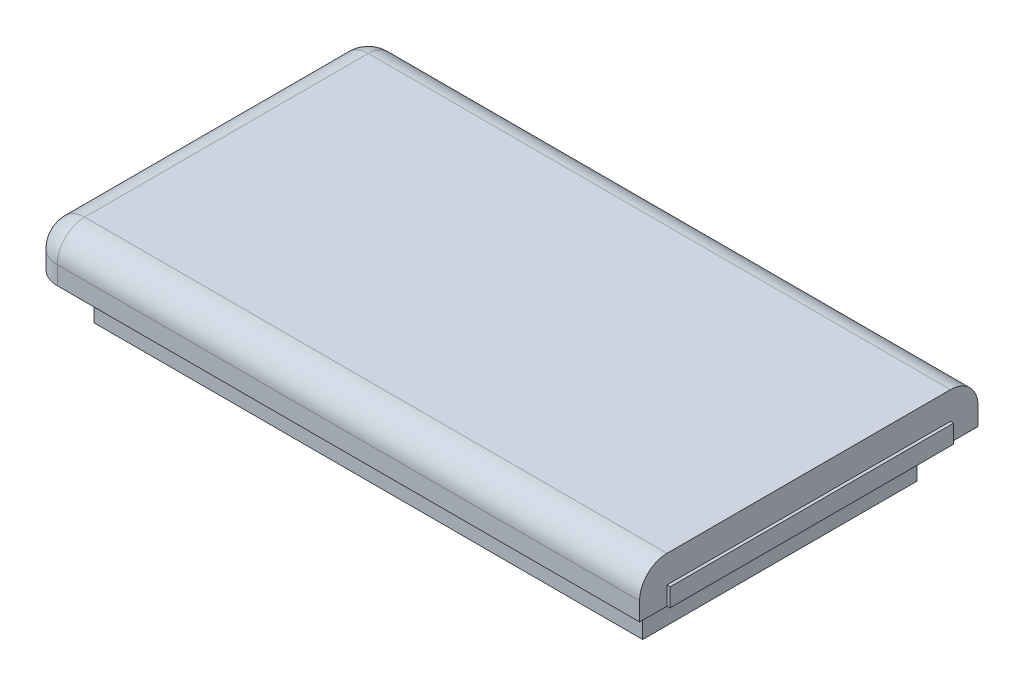
from build123d import *

# Parameters (mm, degrees)
SKETCH1_W           = 67
SKETCH1_H           = 37
BOSS_EXTRUDE2_DEPTH = 5
SKETCH1_4_W         = 60
SKETCH1_4_H         = 30
BOSS_EXTRUDE3_DEPTH = 10
CUT_EXTRUDE1_START  = -10
SKETCH1_6_W         = 54
SKETCH1_6_H         = 24
CUT_EXTRUDE1_DEPTH  = 5
FILLET1_R           = 3
CAVITY1_START       = -3
CAVITY1_OUTLINE_W   = 0.336287878
CAVITY1_OUTLINE_H   = 40
CAVITY1_DEPTH       = 3
CAVITY1_START_2     = -5
CAVITY1_2_DEPTH     = 2
CAVITY1_START_3     = -16.617009358
CAVITY1_3_OUTLINE_W = 10
CAVITY1_3_OUTLINE_H = 2.403805922
CAVITY1_3_DEPTH     = 0.707106781
CAVITY1_START_4     = 4.596194078
CAVITY1_4_OUTLINE_W = 10
CAVITY1_4_OUTLINE_H = 2.090097423
CAVITY1_4_DEPTH     = 0.707106781


# Read off the part's stored shape, not the designer's step: Cavity1
with BuildPart() as part:
    # Sketch1 → Boss-Extrude2 (new body)
    with BuildSketch(Plane(origin=(0, 0, 0), x_dir=(1, 0, 0), z_dir=(0, 1, 0))):
        Rectangle(SKETCH1_W, SKETCH1_H)
    extrude(amount=-BOSS_EXTRUDE2_DEPTH)

    # Sketch1<4> → Boss-Extrude3 (add)
    with BuildSketch(Plane(origin=(0, 0, 0), x_dir=(1, 0, 0), z_dir=(0, 1, 0))):
        Rectangle(SKETCH1_4_W, SKETCH1_4_H)
    extrude(amount=-BOSS_EXTRUDE3_DEPTH)

    # Sketch1<6> → Cut-Extrude1 (cut)
    with BuildSketch(Plane(origin=(0, 0, 0), x_dir=(1, 0, 0), z_dir=(0, 1, 0)).offset(CUT_EXTRUDE1_START)):
        Rectangle(SKETCH1_6_W, SKETCH1_6_H)
    extrude(amount=CUT_EXTRUDE1_DEPTH, mode=Mode.SUBTRACT)

    # Fillet1
    fillet1_edges = [part.edges().sort_by_distance(p)[0] for p in [
        (0, 0, -18.5),
        (0, 0, 18.5),
        (-33.5, 0, 0),
        (-33.5, -2.5, -18.5),
        (-33.5, -2.5, 18.5),
    ]]
    fillet(fillet1_edges, radius=FILLET1_R)

    # Cavity1 outline → Cavity1 (cut)
    with BuildSketch(Plane(origin=(0, 0, 0), x_dir=(1, 0, 0), z_dir=(0, 1, 0)).offset(CAVITY1_START)):
        with Locations((33.331856061, 0)):
            Rectangle(CAVITY1_OUTLINE_W, CAVITY1_OUTLINE_H)
    extrude(amount=CAVITY1_DEPTH, mode=Mode.SUBTRACT)

    # Cavity1 2 outline → Cavity1 2 (cut)
    with BuildSketch(Plane(origin=(0, 0, 0), x_dir=(1, 0, 0), z_dir=(0, 1, 0)).offset(CAVITY1_START_2)):
        with BuildLine():
            Line((33.163712122, -15.5), (33.163712122, -20))
            Line((33.163712122, -20), (33.5, -20))
            Line((33.5, -20), (33.5, -15.509431541))
            ThreePointArc((33.5, -15.509431541), (33.331922177, -15.502358349), (33.163712122, -15.5))
        make_face()
        with BuildLine():
            Line((33.163712122, 20), (33.163712122, 15.5))
            ThreePointArc((33.163712122, 15.5), (33.331922177, 15.502358349), (33.5, 15.509431541))
            Line((33.5, 15.509431541), (33.5, 20))
            Line((33.5, 20), (33.163712122, 20))
        make_face()
    extrude(amount=CAVITY1_2_DEPTH, mode=Mode.SUBTRACT)

    # Cavity1 3 outline → Cavity1 3 (cut)
    with BuildSketch(Plane(origin=(0, 0, 0), x_dir=(1, 0, 0), z_dir=(0, 0.70710678118654, 0.707106781186555)).offset(CAVITY1_START_3)):
        with Locations((18.163712122, 5.798097039)):
            Rectangle(CAVITY1_3_OUTLINE_W, CAVITY1_3_OUTLINE_H)
        with Locations((-15.836287878, 5.798097039)):
            Rectangle(CAVITY1_3_OUTLINE_W, CAVITY1_3_OUTLINE_H)
    extrude(amount=CAVITY1_3_DEPTH, mode=Mode.SUBTRACT)

    # Cavity1 4 outline → Cavity1 4 (cut)
    with BuildSketch(Plane(origin=(0, 0, 0), x_dir=(1, 0, 0), z_dir=(0, 0.70710678118654, 0.707106781186555)).offset(CAVITY1_START_4)):
        with Locations((18.163712122, -16.954951288)):
            Rectangle(CAVITY1_4_OUTLINE_W, CAVITY1_4_OUTLINE_H)
        with Locations((-15.836287878, -16.954951288)):
            Rectangle(CAVITY1_4_OUTLINE_W, CAVITY1_4_OUTLINE_H)
    extrude(amount=CAVITY1_4_DEPTH, mode=Mode.SUBTRACT)


solid = part.part
